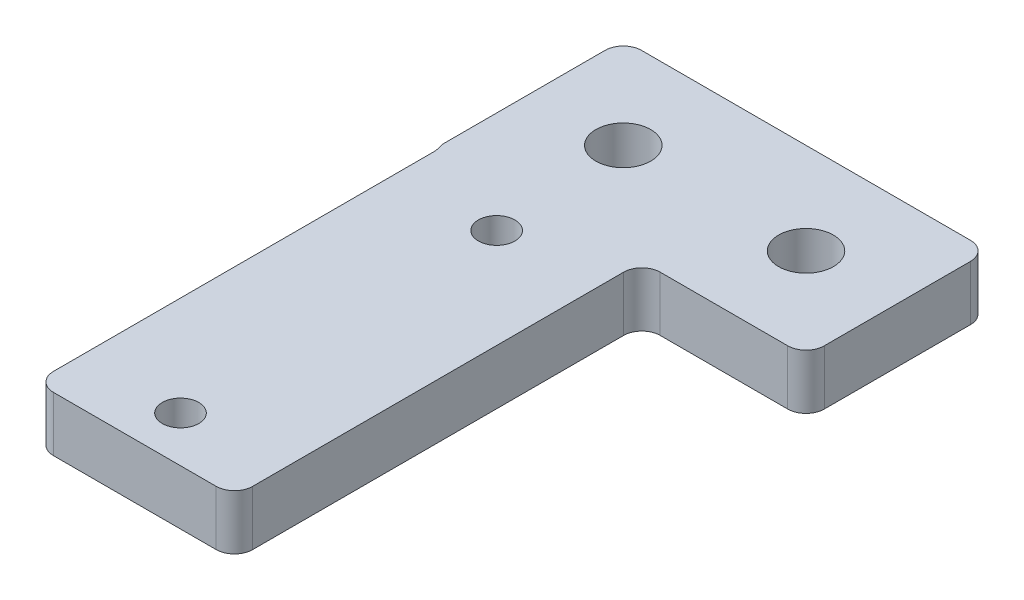
from build123d import *

# Parameters (mm, degrees)
SKETCH1_R           = 1.5
SKETCH1_R_2         = 1
BOSS_EXTRUDE1_DEPTH = 3
FILLET2_R           = 1
FILLET5_R           = 1
FILLET6_R           = 1


with BuildPart() as part:
    # Sketch1 → Boss-Extrude1 (new body)
    with BuildSketch(Plane(origin=(0, 0, 0), x_dir=(1, 0, 0), z_dir=(0, 1, 0))):
        Polygon((11.02, 0), (20, 0), (20, 10), (0, 10), (0, 0), (0.12, 0), (0.12, -22.3), (11.02, -22.3), align=None)
        with Locations(Location((5, 5, 0), (0, 0, 270))):
            Circle(SKETCH1_R, mode=Mode.SUBTRACT)
        with Locations(Location((15, 5, 0), (0, 0, 270))):
            Circle(SKETCH1_R, mode=Mode.SUBTRACT)
        with Locations(Location((5.57, -2.5, 0), (0, 0, 270))):
            Circle(SKETCH1_R_2, mode=Mode.SUBTRACT)
        with Locations(Location((5.57, -19.8, 0), (0, 0, 270))):
            Circle(SKETCH1_R_2, mode=Mode.SUBTRACT)
    extrude(amount=BOSS_EXTRUDE1_DEPTH)

    # Fillet2
    fillet2_edges = [part.edges().sort_by_distance(p)[0] for p in [
        (11.02, 1.5, 22.3),
        (0.12, 1.5, 22.3),
        (0, 1.5, -10),
        (20, 1.5, -10),
        (20, 1.5, 0),
        (11.02, 1.5, 0),
    ]]
    fillet(fillet2_edges, radius=FILLET2_R)

    # Fillet5
    # the kernel refuses this fillet: 1 mm, written as the material it adds along each edge
    with BuildSketch(Plane(origin=(0.12, 0, 0), x_dir=(0, 0, 1), z_dir=(0, 1, 0))) as fillet5_piece_1:
        with BuildLine():
            CenterArc((0.474973683, -1), FILLET5_R, 90, 28.357636576)
            Line((0, -0.12), (-0.009499474, -0.1024))
            ThreePointArc((-0.009499474, -0.1024), (-0.02, -0.06), (-0.02, 0))
            Line((-0.02, 0), (0, 0.02))
            Line((0, 0.02), (0.474973683, 0.02))
            Line((0.474973683, 0.02), (0.474973683, 0))
        make_face()
    extrude(amount=3)

    # Fillet6
    fillet6_edges = [part.edges().sort_by_distance(p)[0] for p in [
        (0, 1.5, 0),
    ]]
    fillet(fillet6_edges, radius=FILLET6_R)


solid = part.part
